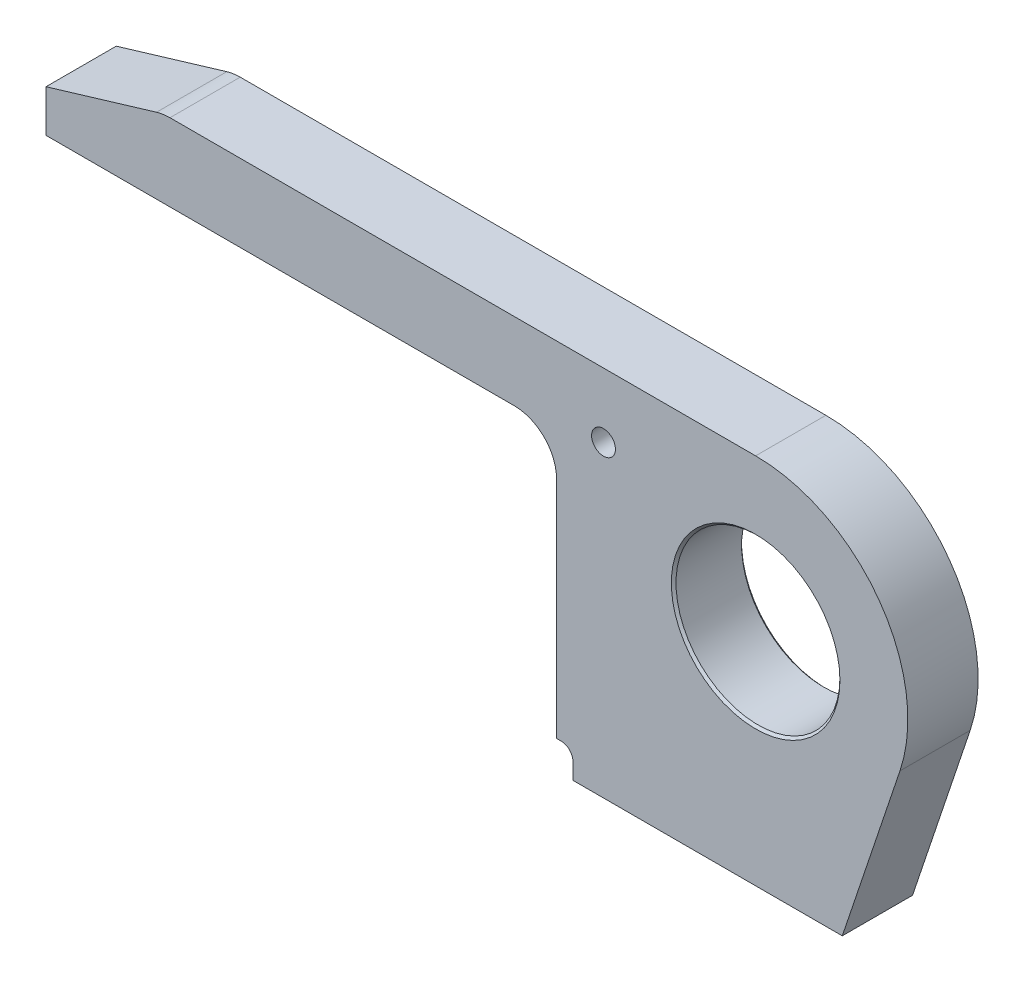
from build123d import *

# Parameters (mm, degrees)
SKETCH_1_R             = 35
SM_BASE_FLANGE_1_DEPTH = 30
FILLET_1_R             = 20
FILLET_2_R             = 13
FILLET_3_R             = 5
HOLE_WIZARD_M12_1_D    = 10.2
CHAMFER_1_SIZE         = 5
CHAMFER_2_SIZE         = 1


# Sheet-metal steps are written as plain solids
with BuildPart() as part:
    # Sketch 1 → 基体-法兰1 (new body)
    with BuildSketch(Plane.XY):
        with BuildLine():
            Line((-303, 50), (-303, 27))
            Line((-303, 27), (-90, 27))
            Line((-90, 27), (-90, -82))
            Line((-90, -82), (-78, -82))
            Line((-78, -82), (-78, -94))
            Line((-78, -94), (37, -94))
            Line((37, -94), (61.618237028, -20.692821595))
            ThreePointArc((61.618237028, -20.692821595), (52.77325745, 37.947111855), (0, 65))
            Line((0, 65), (-253, 65))
            Line((-253, 65), (-303, 50))
        make_face()
        Circle(SKETCH_1_R, mode=Mode.SUBTRACT)
    extrude(amount=-SM_BASE_FLANGE_1_DEPTH)

    # 圆角1
    fillet_1_edges = [part.edges().sort_by_distance(p)[0] for p in [
        (-253, 65, -15),
    ]]
    fillet(fillet_1_edges, radius=FILLET_1_R)

    # 圆角2
    fillet_2_edges = [part.edges().sort_by_distance(p)[0] for p in [
        (-90, 27, -15),
    ]]
    fillet(fillet_2_edges, radius=FILLET_2_R)

    # 圆角3
    fillet_3_edges = [part.edges().sort_by_distance(p)[0] for p in [
        (-78, -82, -15),
    ]]
    fillet(fillet_3_edges, radius=FILLET_3_R)

    # M12 螺纹孔1 (through all)
    with Locations(Plane.XY):
        with Locations((-64.951905284, 37.5)):
            Hole(HOLE_WIZARD_M12_1_D / 2)

    # 倒角1
    chamfer_1_edges = [part.edges().sort_by_distance(p)[0] for p in [
        (-203, 27, 0),
        (-90, -82, -15),
        (-203, 27, -30),
        (-90, -34, 0),
        (-90, -34, -30),
        (-93.807611845, 23.192388155, 0),
        (-93.807611845, 23.192388155, -30),
    ]]
    chamfer(chamfer_1_edges, length=CHAMFER_1_SIZE)

    # 倒角2
    chamfer_2_edges = [part.edges().sort_by_distance(p)[0] for p in [
        (-35, 0, -30),
        (-35, 0, 0),
    ]]
    chamfer(chamfer_2_edges, length=CHAMFER_2_SIZE)


solid = part.part
